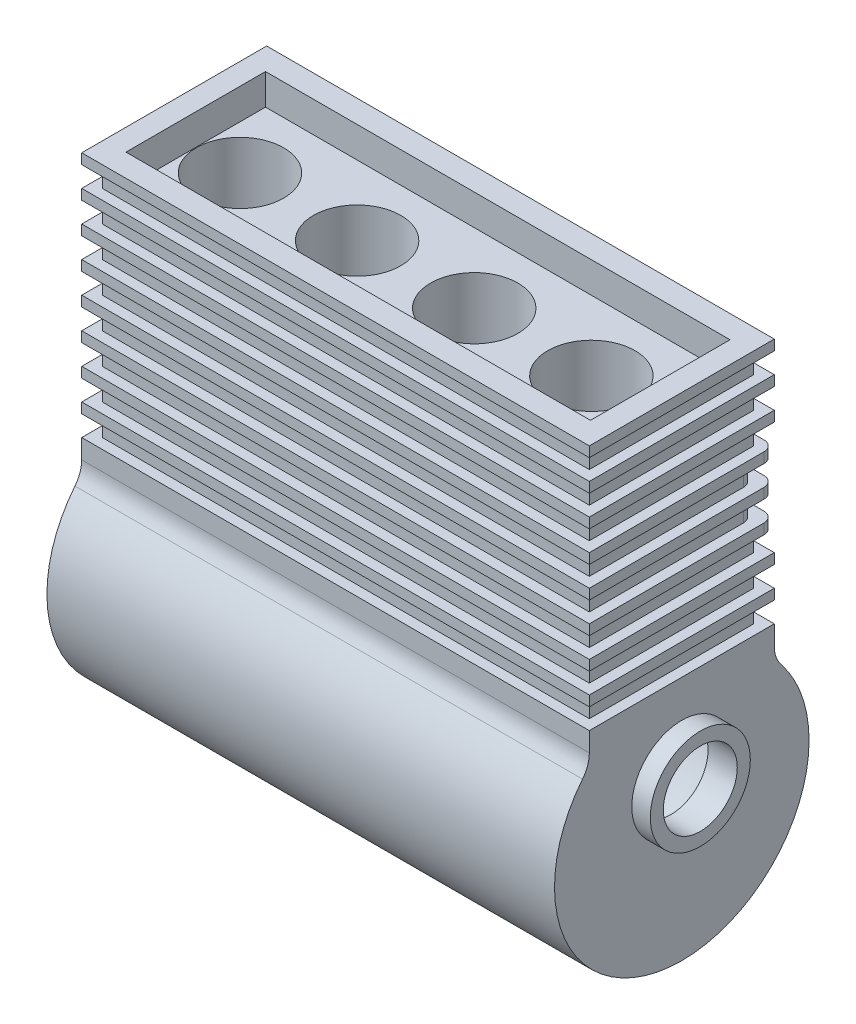
from build123d import *

# Parameters (mm, degrees)
SKETCH1_W                 = 509
SKETCH1_H                 = 180
BOSS_EXTRUDE2_DEPTH       = 200
CUT_EXTRUDE2_DEPTH        = 336.961679362
CUT_EXTRUDE2_DEPTH_BACK   = 200
CUT_EXTRUDE4_DEPTH        = 336.961679362
SKETCH6_W                 = 10
SKETCH6_H                 = 20
CUT_EXTRUDE10_DEPTH       = 541.496068441
SKETCH12_W                = 10
SKETCH12_H                = 20
CUT_EXTRUDE11_DEPTH       = 371.365022647
SKETCH4_W                 = 10
SKETCH4_H                 = 20
CUT_EXTRUDE12_DEPTH       = 371.365022647
FILLET1_R                 = 10
SKETCH17_W                = 452.106634796
SKETCH17_H                = 135.808364938
CUT_EXTRUDE14_DEPTH       = 105
SKETCH16_R                = 36
CUT_EXTRUDE15_DEPTH       = 541.496068441
SKETCH19_W                = 473.271574788
SKETCH19_H                = 158.737049928
CUT_EXTRUDE16_DEPTH       = 47
SKETCH22_W                = 494
SKETCH22_H                = 179.65703746
CUT_EXTRUDE20_DEPTH       = 75
SKETCH23_W                = 472.683659788
SKETCH23_H                = 169.907434924
CUT_EXTRUDE21_DEPTH       = 51
CUT_EXTRUDE22_DEPTH       = 189
CUT_EXTRUDE22_DEPTH_BACK  = 33
SKETCH27_W                = 472.732368702
SKETCH27_H                = 50.997060285
BOSS_EXTRUDE5_DEPTH       = 494
SKETCH30_R                = 36
CUT_EXTRUDE24_DEPTH       = 605.153312137
CUT_EXTRUDE25_DEPTH       = 236.5
BOSS_EXTRUDE10_DEPTH      = 10
BOSS_EXTRUDE10_DEPTH_BACK = 484
SKETCH35_W                = 10
SKETCH35_H                = 20
BOSS_EXTRUDE11_DEPTH      = 10
BOSS_EXTRUDE11_DEPTH_BACK = 484
SKETCH38_W                = 10
SKETCH38_H                = 20
SKETCH40_W                = 160
SKETCH40_H                = 20
CUT_EXTRUDE26_DEPTH       = 484
SKETCH41_W                = 473
SKETCH41_H                = 160.25738228
CUT_EXTRUDE27_DEPTH       = 29
SKETCH39_W                = 10
SKETCH39_H                = 20
BOSS_EXTRUDE12_DEPTH      = 160
SKETCH43_W                = 10.5
SKETCH43_H                = 20
BOSS_EXTRUDE13_DEPTH      = 160
FILLET5_R                 = 30
FILLET6_R                 = 30
FILLET7_R                 = 10
FILLET8_R                 = 10
FILLET9_R                 = 4.9
SKETCH44_R                = 48.683185172
SKETCH44_R_2              = 36
BOSS_EXTRUDE14_DEPTH      = 18
SKETCH45_R                = 51.27217623
SKETCH45_R_2              = 36
BOSS_EXTRUDE15_DEPTH      = 15


with BuildPart() as part:
    # Sketch1 → Boss-Extrude2 (new body)
    with BuildSketch(Plane(origin=(0, 0, 0), x_dir=(1, 0, 0), z_dir=(0, 1, 0))):
        Rectangle(SKETCH1_W, SKETCH1_H)
    extrude(amount=BOSS_EXTRUDE2_DEPTH)

    # Sketch3 → Cut-Extrude2 (cut, two sides: drawn at the far end of the back side and taken through both)
    with BuildSketch(Plane(origin=(0, 200, 0), x_dir=(1, 0, 0), z_dir=(0, 1, 0)).offset(-CUT_EXTRUDE2_DEPTH_BACK)):
        Polygon((254.5, -1179.779607142), (254.5, -90), (254.5, 90), (239.5, 90), (239.5, -90), (239.5, -1179.779607142), (239.5, -3359.338821426), (254.5, -3359.338821426), align=None)
    extrude(amount=CUT_EXTRUDE2_DEPTH + CUT_EXTRUDE2_DEPTH_BACK, mode=Mode.SUBTRACT)

    # Sketch2 → Cut-Extrude4 (cut, through all)
    with BuildSketch(Plane(origin=(0, 200, 0), x_dir=(1, 0, 0), z_dir=(0, 1, 0))):
        with BuildLine():
            Line((-233, 0), (-190.5, 0))
            Line((-190.5, 0), (-148, 0))
            ThreePointArc((-148, 0), (-190.5, 42.5), (-233, 0))
        make_face()
        with BuildLine():
            Line((-148, 0), (-190.5, 0))
            Line((-190.5, 0), (-233, 0))
            ThreePointArc((-233, 0), (-190.5, -42.5), (-148, 0))
        make_face()
        with BuildLine():
            ThreePointArc((-34, 0), (-76.5, 42.5), (-119, 0))
            Line((-119, 0), (-76.5, 0))
            Line((-76.5, 0), (-34, 0))
        make_face()
        with BuildLine():
            Line((-76.5, 0), (-119, 0))
            ThreePointArc((-119, 0), (-76.5, -42.5), (-34, 0))
            Line((-34, 0), (-76.5, 0))
        make_face()
        with BuildLine():
            ThreePointArc((80, 0), (37.5, 42.5), (-5, 0))
            Line((-5, 0), (37.5, 0))
            Line((37.5, 0), (80, 0))
        make_face()
        with BuildLine():
            Line((37.5, 0), (-5, 0))
            ThreePointArc((-5, 0), (37.5, -42.5), (80, 0))
            Line((80, 0), (37.5, 0))
        make_face()
        with BuildLine():
            ThreePointArc((194, 0), (151.5, 42.5), (109, 0))
            Line((109, 0), (151.5, 0))
            Line((151.5, 0), (194, 0))
        make_face()
        with BuildLine():
            Line((151.5, 0), (109, 0))
            ThreePointArc((109, 0), (151.5, -42.5), (194, 0))
            Line((194, 0), (151.5, 0))
        make_face()
    extrude(amount=-CUT_EXTRUDE4_DEPTH, mode=Mode.SUBTRACT)

    # Sketch6 → Cut-Extrude10 (cut, through all)
    with BuildSketch(Plane(origin=(239.5, 0, 0), x_dir=(0, 0, -1), z_dir=(1, 0, 0))):
        with Locations((-85, 185)):
            Rectangle(SKETCH6_W, SKETCH6_H)
        with Locations((-85, 155)):
            Rectangle(SKETCH6_W, SKETCH6_H)
        with Locations((-85, 125)):
            Rectangle(SKETCH6_W, SKETCH6_H)
        with Locations((-85, 95)):
            Rectangle(SKETCH6_W, SKETCH6_H)
        with Locations((-85, 65)):
            Rectangle(SKETCH6_W, SKETCH6_H)
    cut_extrude10 = extrude(amount=-CUT_EXTRUDE10_DEPTH, mode=Mode.SUBTRACT)

    # Sketch12 → Cut-Extrude11 (cut, through all)
    with BuildSketch(Plane.XY.offset(90)):
        with Locations((234.5, 185)):
            Rectangle(SKETCH12_W, SKETCH12_H)
        with Locations((234.5, 155)):
            Rectangle(SKETCH12_W, SKETCH12_H)
        with Locations((234.5, 125)):
            Rectangle(SKETCH12_W, SKETCH12_H)
        with Locations((234.5, 95)):
            Rectangle(SKETCH12_W, SKETCH12_H)
        with Locations((234.5, 65)):
            Rectangle(SKETCH12_W, SKETCH12_H)
    extrude(amount=-CUT_EXTRUDE11_DEPTH, mode=Mode.SUBTRACT)

    # Sketch4 → Cut-Extrude12 (cut, through all)
    with BuildSketch(Plane.XY.offset(90)):
        with Locations((-249.5, 185)):
            Rectangle(SKETCH4_W, SKETCH4_H)
        with Locations((-249.5, 155)):
            Rectangle(SKETCH4_W, SKETCH4_H)
        with Locations((-249.5, 95)):
            Rectangle(SKETCH4_W, SKETCH4_H)
        with Locations((-249.5, 65)):
            Rectangle(SKETCH4_W, SKETCH4_H)
        with Locations((-249.5, 125)):
            Rectangle(SKETCH4_W, SKETCH4_H)
    extrude(amount=-CUT_EXTRUDE12_DEPTH, mode=Mode.SUBTRACT)

    # Mirror3: Cut-Extrude10 across plane
    add(cut_extrude10.mirror(Plane.XY), mode=Mode.SUBTRACT)

    # Fillet1
    fillet1_edges = [part.edges().sort_by_distance(p)[0] for p in [
        (239.5, 170, -90),
        (239.5, 197.5, -90),
        (229.5, 185, -80),
    ]]
    fillet(fillet1_edges, radius=FILLET1_R)

    # Sketch17 → Cut-Extrude14 (cut)
    with BuildSketch(Plane.XZ):
        with Locations((-7.5, 0)):
            Rectangle(SKETCH17_W, SKETCH17_H)
    extrude(amount=-CUT_EXTRUDE14_DEPTH, mode=Mode.SUBTRACT)

    # Sketch16 → Cut-Extrude15 (cut, through all)
    with BuildSketch(Plane(origin=(239.5, 0, 0), x_dir=(0, 0, -1), z_dir=(1, 0, 0))):
        Circle(SKETCH16_R)
    extrude(amount=-CUT_EXTRUDE15_DEPTH, mode=Mode.SUBTRACT)

    # Sketch19 → Cut-Extrude16 (cut)
    with BuildSketch(Plane.XZ):
        with Locations((-7.5, -0.2939575)):
            Rectangle(SKETCH19_W, SKETCH19_H)
    extrude(amount=-CUT_EXTRUDE16_DEPTH, mode=Mode.SUBTRACT)

    # Mirror10: part across plane


with BuildPart() as part_1:
    add(part.part)
    add(part.part.mirror(Plane.ZX.offset(200)))

    # Sketch22 → Cut-Extrude20 (cut)
    with BuildSketch(Plane(origin=(0, 400, 0), x_dir=(1, 0, 0), z_dir=(0, 1, 0))):
        with Locations((-7.5, -0.17148127)):
            Rectangle(SKETCH22_W, SKETCH22_H)
    extrude(amount=-CUT_EXTRUDE20_DEPTH, mode=Mode.SUBTRACT)


with BuildPart() as body_2:
    # of the pieces the cut leaves, the one that is kept (cut_extrude20_keep)
    add(part_1.part.solids().sort_by_distance((239.5, 165, -80))[0])

    # Sketch23 → Cut-Extrude21 (cut)
    with BuildSketch(Plane.XZ):
        with Locations((-7.7939575, 0)):
            Rectangle(SKETCH23_W, SKETCH23_H)
    extrude(amount=-CUT_EXTRUDE21_DEPTH, mode=Mode.SUBTRACT)

    # Sketch27 → Cut-Extrude22 (cut, two sides: drawn at the far end of the back side and taken through both)
    with BuildSketch(Plane.XY.offset(-84.953717462).offset(-CUT_EXTRUDE22_DEPTH_BACK)):
        with Locations((-7.769603043, 25.498530143)):
            Rectangle(SKETCH27_W, SKETCH27_H)
    extrude(amount=CUT_EXTRUDE22_DEPTH + CUT_EXTRUDE22_DEPTH_BACK, mode=Mode.SUBTRACT)

    # Sketch28 → Boss-Extrude5 (add)
    with BuildSketch(Plane(origin=(239.5, 0, 0), x_dir=(0, 0, -1), z_dir=(1, 0, 0))):
        with BuildLine():
            ThreePointArc((-90, 55), (0, -153.945169347), (90, 55))
            Line((90, 55), (90, 0))
            Line((90, 0), (36, 0))
            ThreePointArc((36, 0), (0, 36), (-36, 0))
            Line((-36, 0), (-90, 0))
            Line((-90, 0), (-90, 55))
        make_face()
    extrude(amount=-BOSS_EXTRUDE5_DEPTH)

    # Sketch30 → Cut-Extrude24 (cut, through all)
    with BuildSketch(Plane(origin=(239.5, 0, 0), x_dir=(0, 0, -1), z_dir=(1, 0, 0))):
        Circle(SKETCH30_R)
    extrude(amount=-CUT_EXTRUDE24_DEPTH, mode=Mode.SUBTRACT)

    # Sketch31 → Cut-Extrude25 (cut, symmetric)
    with BuildSketch(Plane.ZY.offset(7.5)):
        with BuildLine():
            Line((-80.405401165, 46.53327076), (80.405401165, 46.53327076))
            ThreePointArc((80.405401165, 46.53327076), (0, -141.157411505), (-80.405401165, 46.53327076))
        make_face()
    extrude(amount=CUT_EXTRUDE25_DEPTH, both=True, mode=Mode.SUBTRACT)

    # Sketch35 → Boss-Extrude10 (add, two sides: drawn at the far end of the back side and taken through both)
    with BuildSketch(Plane.ZY.offset(244.5).offset(-BOSS_EXTRUDE10_DEPTH_BACK)):
        with Locations((85, 65)):
            Rectangle(SKETCH35_W, SKETCH35_H)
    extrude(amount=BOSS_EXTRUDE10_DEPTH + BOSS_EXTRUDE10_DEPTH_BACK)

    # Sketch38 → Boss-Extrude11 (add, two sides: drawn at the far end of the back side and taken through both)
    with BuildSketch(Plane.ZY.offset(244.5).offset(-BOSS_EXTRUDE11_DEPTH_BACK)):
        with Locations((-85, 65)):
            Rectangle(SKETCH38_W, SKETCH38_H)
    extrude(amount=BOSS_EXTRUDE11_DEPTH + BOSS_EXTRUDE11_DEPTH_BACK)

    # Sketch40 → Cut-Extrude26 (cut)
    with BuildSketch(Plane.ZY.offset(244.5)):
        with Locations((0, 65)):
            Rectangle(SKETCH40_W, SKETCH40_H)
    extrude(amount=-CUT_EXTRUDE26_DEPTH, mode=Mode.SUBTRACT)

    # Sketch41 → Cut-Extrude27 (cut)
    with BuildSketch(Plane(origin=(0, 55, 0), x_dir=(1, 0, 0), z_dir=(0, 1, 0))):
        with Locations((-7.5, 0)):
            Rectangle(SKETCH41_W, SKETCH41_H)
    extrude(amount=-CUT_EXTRUDE27_DEPTH, mode=Mode.SUBTRACT)

    # Sketch39 → Boss-Extrude12 (add)
    with BuildSketch(Plane(origin=(0, 0, 80), x_dir=(-1, 0, 0), z_dir=(0, 0, -1))):
        with Locations((249.5, 65)):
            Rectangle(SKETCH39_W, SKETCH39_H)
    extrude(amount=BOSS_EXTRUDE12_DEPTH)

    # Sketch43 → Boss-Extrude13 (add)
    with BuildSketch(Plane(origin=(0, 0, 80), x_dir=(-1, 0, 0), z_dir=(0, 0, -1))):
        with Locations((-234.25, 65)):
            Rectangle(SKETCH43_W, SKETCH43_H)
    extrude(amount=BOSS_EXTRUDE13_DEPTH)

    # Fillet5
    fillet5_edges = [body_2.edges().sort_by_distance(p)[0] for p in [
        (-7.5, 55, 90),
    ]]
    fillet(fillet5_edges, radius=FILLET5_R)

    # Fillet6
    fillet6_edges = [body_2.edges().sort_by_distance(p)[0] for p in [
        (-7.5, 55, -90),
    ]]
    fillet(fillet6_edges, radius=FILLET6_R)

    # Fillet7
    fillet7_edges = [body_2.edges().sort_by_distance(p)[0] for p in [
        (-7.5, 75, -67.904182469),
    ]]
    fillet(fillet7_edges, radius=FILLET7_R)

    # Fillet8
    fillet8_edges = [body_2.edges().sort_by_distance(p)[0] for p in [
        (-7.5, 75, 67.904182469),
    ]]
    fillet(fillet8_edges, radius=FILLET8_R)

    # Fillet9
    # the kernel refuses this fillet: 4.9 mm, written as the material it takes off along each edge
    with BuildSketch(Plane(origin=(228.547872394, 51, 80.12869114), x_dir=(0, 0, 1), z_dir=(-1, 0, 0)), Plane(origin=(-244, 51, -80.12869114), x_dir=(0, 0, -1), z_dir=(1, 0, 0))) as fillet9_piece_1:
        with BuildLine():
            CenterArc((4.816637832, 4.9), FILLET9_R, 190.583802597, 79.416197403)
            Line((0, 4), (0, 0))
            Line((0, 0), (4.816637832, 0))
        make_face()
    extrude(amount=472.547872394, mode=Mode.SUBTRACT)

    # Sketch44 → Boss-Extrude14 (add)
    with BuildSketch(Plane(origin=(239.5, 0, 0), x_dir=(0, 0, -1), z_dir=(1, 0, 0))):
        Circle(SKETCH44_R)
        Circle(SKETCH44_R_2, mode=Mode.SUBTRACT)
    extrude(amount=BOSS_EXTRUDE14_DEPTH)

    # Sketch45 → Boss-Extrude15 (add)
    with BuildSketch(Plane.ZY.offset(254.5)):
        with Locations(Location((0, 0, 0), (0, 0, 180))):
            Circle(SKETCH45_R)
        with Locations(Location((0, 0, 0), (0, 0, 180))):
            Circle(SKETCH45_R_2, mode=Mode.SUBTRACT)
    extrude(amount=BOSS_EXTRUDE15_DEPTH)


solid = body_2.part
